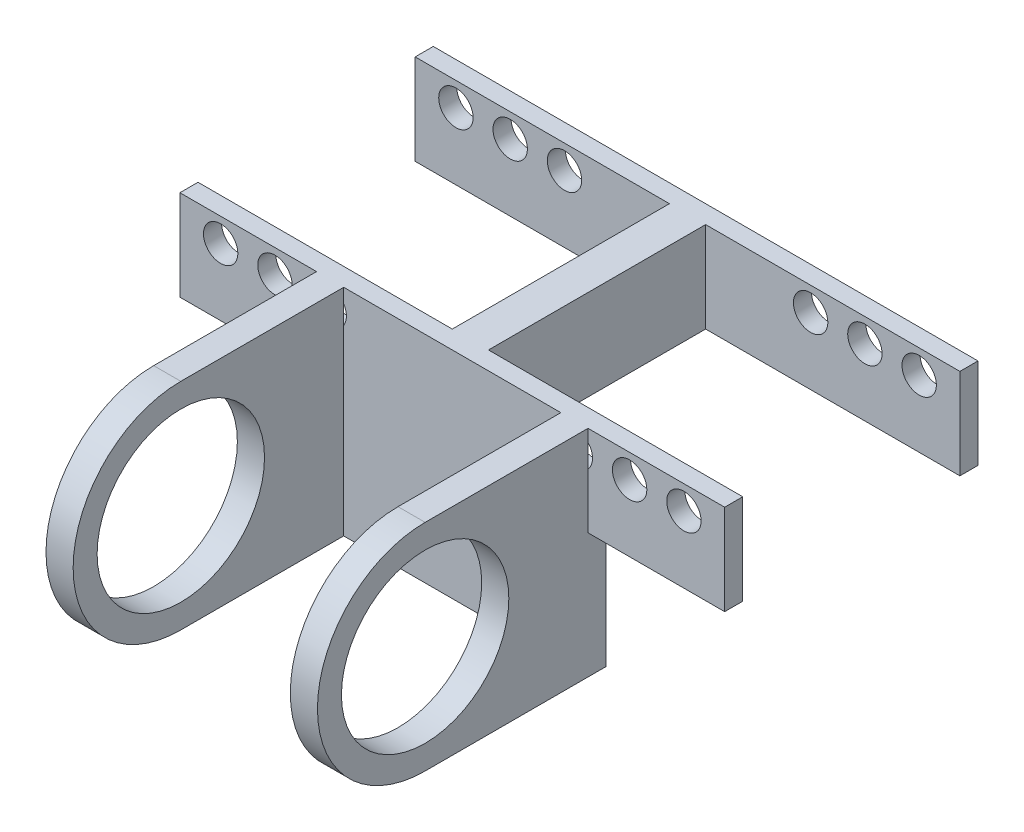
from build123d import *

# Parameters (mm, degrees)
BOSS_EXTRUDE1_DEPTH      = 2
BOSS_EXTRUDE1_DEPTH_BACK = 26
SKETCH1_W                = 10
SKETCH1_H                = 60.199075214
SKETCH1_R                = 1.9
SKETCH2_W                = 28.099537607
SKETCH2_H                = 24
CUT_EXTRUDE1_DEPTH       = 26
BOSS_EXTRUDE3_DEPTH      = 13
BOSS_EXTRUDE3_DEPTH_BACK = 17
SKETCH6_R                = 9.25
SKETCH7_W                = 24
SKETCH7_H                = 29.9
CUT_EXTRUDE3_DEPTH       = 64.671407061


with BuildPart() as part:
    # Sketch1 → Boss-Extrude1 (new, two sides: drawn at the far end of the back side and taken through both)
    with BuildSketch(Plane(origin=(-91.988910101, -76.595483125, 0), x_dir=(0, 1, 0), z_dir=(0, 0, 1)).offset(-BOSS_EXTRUDE1_DEPTH_BACK)):
        with Locations((50.215119979, -72.389372494)):
            Rectangle(SKETCH1_W, SKETCH1_H)
        with Locations((52.595483125, -97.988910101)):
            Circle(SKETCH1_R, mode=Mode.SUBTRACT)
        with Locations((52.595483125, -91.988910101)):
            Circle(SKETCH1_R, mode=Mode.SUBTRACT)
        with Locations((52.595483125, -85.988910101)):
            Circle(SKETCH1_R, mode=Mode.SUBTRACT)
        with Locations((52.595483125, -58.789834887)):
            Circle(SKETCH1_R, mode=Mode.SUBTRACT)
        with Locations((52.595483125, -52.789834887)):
            Circle(SKETCH1_R, mode=Mode.SUBTRACT)
        with Locations((52.595483125, -46.789834887)):
            Circle(SKETCH1_R, mode=Mode.SUBTRACT)
    extrude(amount=BOSS_EXTRUDE1_DEPTH + BOSS_EXTRUDE1_DEPTH_BACK)

    # Sketch2 → Cut-Extrude1 (cut)
    with BuildSketch(Plane.XZ.offset(31.380363146)):
        with Locations((-35.649306411, -12)):
            Rectangle(SKETCH2_W, SKETCH2_H)
        with Locations((-3.549768804, -12)):
            Rectangle(SKETCH2_W, SKETCH2_H)
    extrude(amount=-CUT_EXTRUDE1_DEPTH, mode=Mode.SUBTRACT)

    # Sketch6 → Boss-Extrude3 (add, two sides: drawn at the far end of the back side and taken through both)
    with BuildSketch(Plane(origin=(-21.599537607, -143.155271129, -4.469240744), x_dir=(0, 0, -1), z_dir=(-1, 0, 0)).offset(-BOSS_EXTRUDE3_DEPTH_BACK)):
        with BuildLine():
            Line((-24.469240744, -97.974907982), (-4.469240744, -97.974907982))
            Line((-4.469240744, -97.974907982), (-4.469240744, -111.774907982))
            Line((-4.469240744, -111.774907982), (-6.469240744, -111.774907982))
            Line((-6.469240744, -111.774907982), (-6.469240744, -121.774907982))
            Line((-6.469240744, -121.774907982), (-24.469240744, -121.774907982))
            ThreePointArc((-24.469240744, -121.774907982), (-36.369240744, -109.874907982), (-24.469240744, -97.974907982))
        make_face()
        with Locations((-24.469240744, -109.874907982)):
            Circle(SKETCH6_R, mode=Mode.SUBTRACT)
    extrude(amount=BOSS_EXTRUDE3_DEPTH + BOSS_EXTRUDE3_DEPTH_BACK)

    # Sketch7 → Cut-Extrude3 (cut, through all)
    with BuildSketch(Plane.XZ.offset(45.180363146)):
        with Locations((-19.599537607, 16.95)):
            Rectangle(SKETCH7_W, SKETCH7_H)
    extrude(amount=-CUT_EXTRUDE3_DEPTH, mode=Mode.SUBTRACT)


solid = part.part
